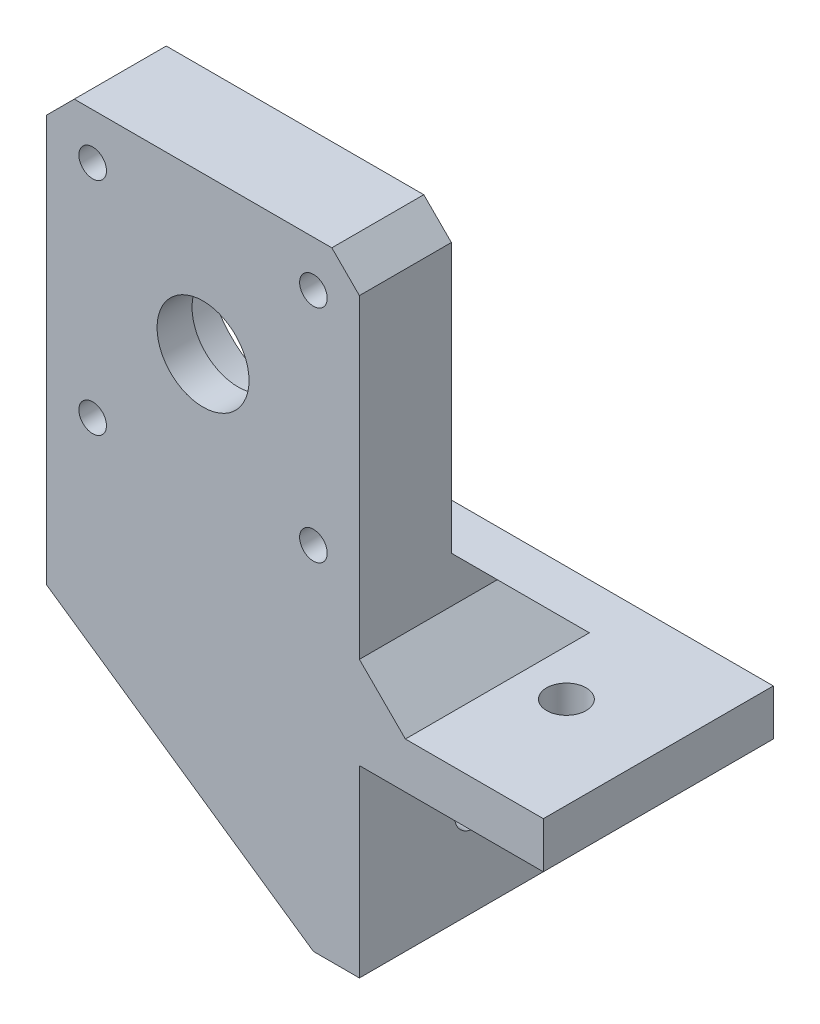
from build123d import *

# Parameters (mm, degrees)
SKETCH_1_R          = 5
SKETCH_1_R_2        = 1.5
EXTRUDE_1_DEPTH     = 25
SKETCH_2_R          = 2.15
CUT_EXTRUDE_1_DEPTH = 30
SKETCH_3_R          = 2.15
CUT_EXTRUDE_2_DEPTH = 30
SKETCH_4_W          = 34
SKETCH_4_H          = 42.25
CUT_EXTRUDE_3_DEPTH = 15
CHAMFER_1_SIZE      = 5
CHAMFER_2_SIZE      = 3
SKETCH_6_R          = 9.75
CUT_EXTRUDE_5_DEPTH = 6.2
EXTRUDE_2_DEPTH     = 5
CHAMFER_3_SIZE      = 10


with BuildPart() as part:
    # 草图1 → 凸台-拉伸1 (new body)
    with BuildSketch(Plane.XY):
        Polygon((0, 0), (0, 20), (20, 20), (20, 25), (0, 25), (0, 67.25), (-34, 67.25), (-34, 20), (-5, 20), (-5, 0), align=None)
        with Locations((-17, 50.25)):
            Circle(SKETCH_1_R, mode=Mode.SUBTRACT)
        with Locations((-29, 62.25)):
            Circle(SKETCH_1_R_2, mode=Mode.SUBTRACT)
        with Locations((-5, 62.25)):
            Circle(SKETCH_1_R_2, mode=Mode.SUBTRACT)
        with Locations((-29, 38.25)):
            Circle(SKETCH_1_R_2, mode=Mode.SUBTRACT)
        with Locations((-5, 38.25)):
            Circle(SKETCH_1_R_2, mode=Mode.SUBTRACT)
    extrude(amount=EXTRUDE_1_DEPTH)

    # 草图2 → 切除-拉伸1 (cut)
    with BuildSketch(Plane(origin=(0, 0, 0), x_dir=(0, 0, -1), z_dir=(1, 0, 0))):
        with Locations((-12.5, 10)):
            Circle(SKETCH_2_R)
    extrude(amount=-CUT_EXTRUDE_1_DEPTH, mode=Mode.SUBTRACT)

    # 草图3 → 切除-拉伸2 (cut)
    with BuildSketch(Plane.XZ.offset(-20)):
        with Locations(Location((10, 12.5, 0), (0, 0, 270))):
            Circle(SKETCH_3_R)
    extrude(amount=-CUT_EXTRUDE_2_DEPTH, mode=Mode.SUBTRACT)

    # 草图4 → 切除-拉伸3 (cut)
    with BuildSketch(Plane(origin=(0, 0, 0), x_dir=(-1, 0, 0), z_dir=(0, 0, -1))):
        with Locations((17, 46.125)):
            Rectangle(SKETCH_4_W, SKETCH_4_H)
    extrude(amount=-CUT_EXTRUDE_3_DEPTH, mode=Mode.SUBTRACT)

    # 倒角1
    chamfer_1_edges = [part.edges().sort_by_distance(p)[0] for p in [
        (-5, 20, 12.5),
        (0, 25, 20),
    ]]
    chamfer(chamfer_1_edges, length=CHAMFER_1_SIZE)

    # 倒角2
    chamfer_2_edges = [part.edges().sort_by_distance(p)[0] for p in [
        (-34, 67.25, 20),
        (0, 67.25, 20),
    ]]
    chamfer(chamfer_2_edges, length=CHAMFER_2_SIZE)

    # 草图6 → 切除-拉伸5 (cut)
    with BuildSketch(Plane(origin=(0, 0, 15), x_dir=(-1, 0, 0), z_dir=(0, 0, -1))):
        with Locations((17, 50.25)):
            Circle(SKETCH_6_R)
    extrude(amount=-CUT_EXTRUDE_5_DEPTH, mode=Mode.SUBTRACT)

    # 草图7 → 凸台-拉伸2 (add)
    with BuildSketch(Plane.XY.offset(25)):
        Polygon((-34, 20), (-10, 20), (-5, 15), (-5, 0), align=None)
    extrude(amount=-EXTRUDE_2_DEPTH)

    # 倒角3
    # the kernel refuses this chamfer: 10 mm, written as the material it adds along each edge
    with BuildSketch(Plane(origin=(-34, 25, 15), x_dir=(0, 0.9996219169112968, 0.027495876610586317), z_dir=(1, 0, 0))) as chamfer_3_piece_1_section:
        Polygon((CHAMFER_3_SIZE * 0.999621916911, -CHAMFER_3_SIZE * 0.0274958766106), (-CHAMFER_3_SIZE * 0.0274958766106, -CHAMFER_3_SIZE * 0.999621916911), (0, 0), align=None)
    chamfer_3_piece_1 = extrude(amount=64.71682988, mode=Mode.PRIVATE)
    chamfer_3_piece_1 = split(chamfer_3_piece_1, bisect_by=Plane(origin=(0, 28.236246517, 11.669766102), z_dir=(-1, 0, 0)), keep=Keep.TOP, mode=Mode.PRIVATE)
    chamfer_3_piece_1 = split(chamfer_3_piece_1, bisect_by=Plane(origin=(-7.726936811, 37.726936811, 11.669766102), z_dir=(-0.7071067811865476, -0.7071067811865476, 0)), keep=Keep.TOP, mode=Mode.PRIVATE)
    add(chamfer_3_piece_1)
    with BuildSketch(Plane(origin=(-34, 25, 15), x_dir=(0, 0.9996219169112968, 0.027495876610586317), z_dir=(1, 0, 0))) as chamfer_3_piece_2_section:
        Polygon((CHAMFER_3_SIZE * 0.999621916911, -CHAMFER_3_SIZE * 0.0274958766106), (-CHAMFER_3_SIZE * 0.0274958766106, -CHAMFER_3_SIZE * 0.999621916911), (0, 0), align=None)
    chamfer_3_piece_2 = extrude(amount=64.71682988, mode=Mode.PRIVATE)
    chamfer_3_piece_2 = split(chamfer_3_piece_2, bisect_by=Plane(origin=(0, 26.323776193, 10.636124878), z_dir=(1, 0, 0)), keep=Keep.TOP, mode=Mode.PRIVATE)
    chamfer_3_piece_2 = split(chamfer_3_piece_2, bisect_by=Plane(origin=(2.757167855, 27.242832145, 10.636124878), z_dir=(-0.7071067811865476, -0.7071067811865476, 0)), keep=Keep.TOP, mode=Mode.PRIVATE)
    add(chamfer_3_piece_2)
    with BuildSketch(Plane(origin=(-34, 25, 15), x_dir=(0, 0.9996219169112968, 0.027495876610586317), z_dir=(1, 0, 0))) as chamfer_3_piece_3_section:
        Polygon((CHAMFER_3_SIZE * 0.999621916911, -CHAMFER_3_SIZE * 0.0274958766106), (-CHAMFER_3_SIZE * 0.0274958766106, -CHAMFER_3_SIZE * 0.999621916911), (0, 0), align=None)
    chamfer_3_piece_3 = extrude(amount=64.71682988, mode=Mode.PRIVATE)
    chamfer_3_piece_3 = split(chamfer_3_piece_3, bisect_by=Plane(origin=(0, 32.729927819, 14.022430088), z_dir=(-1, 0, 0)), keep=Keep.TOP, mode=Mode.PRIVATE)
    chamfer_3_piece_3 = split(chamfer_3_piece_3, bisect_by=Plane(origin=(-2.047445864, 32.047445864, 14.022430088), z_dir=(0.7071067811865476, 0.7071067811865476, 0)), keep=Keep.TOP, mode=Mode.PRIVATE)
    add(chamfer_3_piece_3)


solid = part.part
